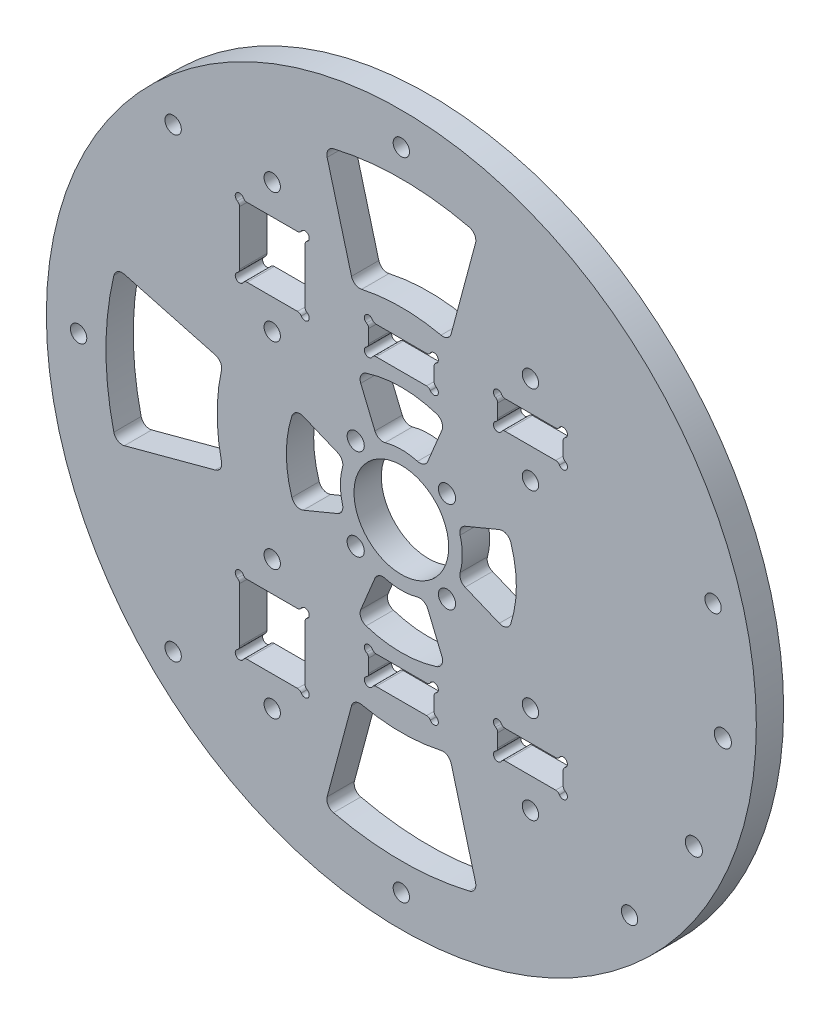
from build123d import *

# Parameters (mm, degrees)
SKETCH1_R                = 82.5
SKETCH1_R_2              = 1.89865
SKETCH1_R_3              = 1.9939
SKETCH1_R_4              = 11
BOSS_EXTRUDE1_DEPTH      = 6.35
SKETCH5_W                = 15.2
SKETCH5_H                = 16.075
CUT_EXTRUDE4_DEPTH       = 117.845293016
SKETCH6_R                = 1
CUT_EXTRUDE5_DEPTH       = 117.845293016
FILLET1_R                = 1
SKETCH10_W               = 52.512742007
SKETCH10_H               = 39.376351637
SKETCH10_W_2             = 54.285324016
SKETCH10_H_2             = 41.487938284
BOSS_EXTRUDE2_DEPTH      = 6.35
SKETCH11_W               = 15.2
SKETCH11_H               = 6.55
CUT_EXTRUDE8_DEPTH       = 117.845293016
SKETCH13_R               = 1
CUT_EXTRUDE9_DEPTH       = 117.845293016
FILLET2_R                = 1
LPATTERN3_COUNT          = 2
LPATTERN3_PITCH          = 30
FILLET2_OF_LPATTERN3_R   = 1
MIRROR3_DEPTH            = 6.35
SKETCH14_R               = 1.89865
CUT_EXTRUDE10_DEPTH      = 117.845293016
CUT_EXTRUDE11_DEPTH      = 10
FILLET3_R                = 2
CIRPATTERN1_COUNT        = 4
FILLET3_OF_CIRPATTERN1_R = 2
CUT_EXTRUDE12_DEPTH      = 117.845293016
FILLET4_R                = 2
CIRPATTERN2_COUNT        = 4
FILLET4_OF_CIRPATTERN2_R = 2
CUT_EXTRUDE13_START      = -3.571875
SKETCH17_R               = 4.7625
SKETCH17_R_2             = 1.89865
CUT_EXTRUDE13_DEPTH      = 3.571875


# Read off the part's stored shape, not the designer's step: Mirror3
with BuildPart() as part:
    # Sketch1 → Boss-Extrude1 (new body)
    with BuildSketch(Plane.XY):
        Circle(SKETCH1_R)
        with Locations((72.444436972, 19.411428383)):
            Circle(SKETCH1_R_2, mode=Mode.SUBTRACT)
        with Locations((74.714602357, -6.536680706)):
            Circle(SKETCH1_R_3, mode=Mode.SUBTRACT)
        Circle(SKETCH1_R_4, mode=Mode.SUBTRACT)
        with Locations((67.973084028, -31.696369631)):
            Circle(SKETCH1_R_3, mode=Mode.SUBTRACT)
        with Locations((10.606601718, -10.606601718)):
            Circle(SKETCH1_R_3, mode=Mode.SUBTRACT)
        with Locations((0, -75)):
            Circle(SKETCH1_R_2, mode=Mode.SUBTRACT)
        with Locations((-10.606601718, -10.606601718)):
            Circle(SKETCH1_R_3, mode=Mode.SUBTRACT)
        with Locations((-10.606601718, 10.606601718)):
            Circle(SKETCH1_R_3, mode=Mode.SUBTRACT)
        with Locations((10.606601718, 10.606601718)):
            Circle(SKETCH1_R_3, mode=Mode.SUBTRACT)
        with Locations((-53.033008589, -53.033008589)):
            Circle(SKETCH1_R_2, mode=Mode.SUBTRACT)
        with Locations((-75, 0)):
            Circle(SKETCH1_R_2, mode=Mode.SUBTRACT)
        with Locations((-53.033008589, 53.033008589)):
            Circle(SKETCH1_R_2, mode=Mode.SUBTRACT)
        with Locations((0, 75)):
            Circle(SKETCH1_R_2, mode=Mode.SUBTRACT)
        with Locations((53.033008589, -53.033008589)):
            Circle(SKETCH1_R_2, mode=Mode.SUBTRACT)
    extrude(amount=BOSS_EXTRUDE1_DEPTH)

    # Sketch5 → Cut-Extrude4 (cut, through all)
    with BuildSketch(Plane.XY.offset(6.35)):
        with Locations((-30, -37.9375)):
            Rectangle(SKETCH5_W, SKETCH5_H)
        with Locations((-30, 37.9375)):
            Rectangle(SKETCH5_W, SKETCH5_H)
        with Locations((30, 37.9375)):
            Rectangle(SKETCH5_W, SKETCH5_H)
        with Locations((0, -37.9375)):
            Rectangle(SKETCH5_W, SKETCH5_H)
        with Locations((30, -37.9375)):
            Rectangle(SKETCH5_W, SKETCH5_H)
        with Locations((0, 37.9375)):
            Rectangle(SKETCH5_W, SKETCH5_H)
    extrude(amount=-CUT_EXTRUDE4_DEPTH, mode=Mode.SUBTRACT)

    # Sketch6 → Cut-Extrude5 (cut, through all)
    with BuildSketch(Plane.XY.offset(6.35)):
        with Locations((-37.6, 45.975)):
            Circle(SKETCH6_R)
        with Locations((-22.4, 45.975)):
            Circle(SKETCH6_R)
        with Locations((-37.6, 29.9)):
            Circle(SKETCH6_R)
        with Locations((-22.4, 29.9)):
            Circle(SKETCH6_R)
        with Locations((-7.6, 45.975)):
            Circle(SKETCH6_R)
        with Locations((7.6, 45.975)):
            Circle(SKETCH6_R)
        with Locations((-7.6, 29.9)):
            Circle(SKETCH6_R)
        with Locations((7.6, 29.9)):
            Circle(SKETCH6_R)
        with Locations((22.4, 45.975)):
            Circle(SKETCH6_R)
        with Locations((37.6, 45.975)):
            Circle(SKETCH6_R)
        with Locations((22.4, 29.9)):
            Circle(SKETCH6_R)
        with Locations((37.6, 29.9)):
            Circle(SKETCH6_R)
        with Locations((-37.6, -29.9)):
            Circle(SKETCH6_R)
        with Locations((-22.4, -29.9)):
            Circle(SKETCH6_R)
        with Locations((-37.6, -45.975)):
            Circle(SKETCH6_R)
        with Locations((-22.4, -45.975)):
            Circle(SKETCH6_R)
        with Locations((-7.6, -29.9)):
            Circle(SKETCH6_R)
        with Locations((7.6, -29.9)):
            Circle(SKETCH6_R)
        with Locations((-7.6, -45.975)):
            Circle(SKETCH6_R)
        with Locations((7.6, -45.975)):
            Circle(SKETCH6_R)
        with Locations((22.4, -29.9)):
            Circle(SKETCH6_R)
        with Locations((37.6, -29.9)):
            Circle(SKETCH6_R)
        with Locations((22.4, -45.975)):
            Circle(SKETCH6_R)
        with Locations((37.6, -45.975)):
            Circle(SKETCH6_R)
    extrude(amount=-CUT_EXTRUDE5_DEPTH, mode=Mode.SUBTRACT)

    # Fillet1
    fillet1_edges = [part.edges().sort_by_distance(p)[0] for p in [
        (-37.6, 44.975, 3.175),
        (-36.6, 45.975, 3.175),
        (-22.4, 44.975, 3.175),
        (-23.4, 45.975, 3.175),
        (-37.6, 30.9, 3.175),
        (-36.6, 29.9, 3.175),
        (-23.4, 29.9, 3.175),
        (-22.4, 30.9, 3.175),
        (-7.6, 44.975, 3.175),
        (-6.6, 45.975, 3.175),
        (7.6, 44.975, 3.175),
        (6.6, 45.975, 3.175),
        (-7.6, 30.9, 3.175),
        (-6.6, 29.9, 3.175),
        (6.6, 29.9, 3.175),
        (7.6, 30.9, 3.175),
        (22.4, 44.975, 3.175),
        (23.4, 45.975, 3.175),
        (37.6, 44.975, 3.175),
        (36.6, 45.975, 3.175),
        (22.4, 30.9, 3.175),
        (23.4, 29.9, 3.175),
        (36.6, 29.9, 3.175),
        (37.6, 30.9, 3.175),
        (-36.6, -29.9, 3.175),
        (-37.6, -30.9, 3.175),
        (-22.4, -30.9, 3.175),
        (-23.4, -29.9, 3.175),
        (-36.6, -45.975, 3.175),
        (-37.6, -44.975, 3.175),
        (-23.4, -45.975, 3.175),
        (-22.4, -44.975, 3.175),
        (-6.6, -29.9, 3.175),
        (-7.6, -30.9, 3.175),
        (7.6, -30.9, 3.175),
        (6.6, -29.9, 3.175),
        (-6.6, -45.975, 3.175),
        (-7.6, -44.975, 3.175),
        (6.6, -45.975, 3.175),
        (7.6, -44.975, 3.175),
        (23.4, -29.9, 3.175),
        (22.4, -30.9, 3.175),
        (37.6, -30.9, 3.175),
        (36.6, -29.9, 3.175),
        (23.4, -45.975, 3.175),
        (22.4, -44.975, 3.175),
        (36.6, -45.975, 3.175),
        (37.6, -44.975, 3.175),
    ]]
    fillet(fillet1_edges, radius=FILLET1_R)

    # Sketch10 → Boss-Extrude2 (add, through all)
    with BuildSketch(Plane(origin=(0, 0, 0), x_dir=(-1, 0, 0), z_dir=(0, 0, -1))):
        with Locations((-14.291442444, 45.267678683)):
            Rectangle(SKETCH10_W, SKETCH10_H)
        with Locations((-15.177733449, -45.976574892)):
            Rectangle(SKETCH10_W_2, SKETCH10_H_2)
    extrude(amount=-BOSS_EXTRUDE2_DEPTH)

    # Sketch11 → Cut-Extrude8 (cut, through all)
    with BuildSketch(Plane(origin=(0, 0, 0), x_dir=(-1, 0, 0), z_dir=(0, 0, -1))):
        with Locations((0, 33.175)):
            Rectangle(SKETCH11_W, SKETCH11_H)
    cut_extrude8 = extrude(amount=-CUT_EXTRUDE8_DEPTH, mode=Mode.SUBTRACT)

    # Sketch13 → Cut-Extrude9 (cut, through all)
    with BuildSketch(Plane(origin=(0, 0, 0), x_dir=(-1, 0, 0), z_dir=(0, 0, -1))):
        with Locations((-7.6, 36.45)):
            Circle(SKETCH13_R)
        with Locations((-7.6, 29.9)):
            Circle(SKETCH13_R)
        with Locations((7.6, 29.9)):
            Circle(SKETCH13_R)
        with Locations((7.6, 36.45)):
            Circle(SKETCH13_R)
    cut_extrude9 = extrude(amount=-CUT_EXTRUDE9_DEPTH, mode=Mode.SUBTRACT)

    # Fillet2
    fillet2_edges = [part.edges().sort_by_distance(p)[0] for p in [
        (6.6, 36.45, 3.175),
        (7.6, 35.45, 3.175),
        (-6.6, 36.45, 3.175),
        (7.6, 30.9, 3.175),
        (-6.6, 29.9, 3.175),
        (6.6, 29.9, 3.175),
        (-7.6, 30.9, 3.175),
        (-7.6, 35.45, 3.175),
    ]]
    fillet(fillet2_edges, radius=FILLET2_R)

    # LPattern3: Cut-Extrude8, Cut-Extrude9 ×2
    with Locations(*[(i * LPATTERN3_PITCH, 0, 0) for i in range(1, LPATTERN3_COUNT)]):
        add(cut_extrude8, mode=Mode.SUBTRACT)
        add(cut_extrude9, mode=Mode.SUBTRACT)

    # Fillet2 of LPattern3
    fillet2_of_lpattern3_edges = [part.edges().sort_by_distance(p)[0] for p in [
        (36.6, 36.45, 3.175),
        (37.6, 35.45, 3.175),
        (23.4, 36.45, 3.175),
        (37.6, 30.9, 3.175),
        (23.4, 29.9, 3.175),
        (36.6, 29.9, 3.175),
        (22.4, 30.9, 3.175),
        (22.4, 35.45, 3.175),
    ]]
    fillet(fillet2_of_lpattern3_edges, radius=FILLET2_OF_LPATTERN3_R)

    # Mirror3 outline → Mirror3 (cut)
    with BuildSketch(Plane.XY):
        with BuildLine():
            Line((-5.867949192, -36.45), (5.867949192, -36.45))
            ThreePointArc((5.867949192, -36.45), (6.367949192, -36.583974596), (6.733974596, -36.95))
            ThreePointArc((6.733974596, -36.95), (8.307106781, -37.157106781), (8.1, -35.583974596))
            ThreePointArc((8.1, -35.583974596), (7.733974596, -35.217949192), (7.6, -34.717949192))
            Line((7.6, -34.717949192), (7.6, -31.632050808))
            ThreePointArc((7.6, -31.632050808), (7.733974596, -31.132050808), (8.1, -30.766025404))
            ThreePointArc((8.1, -30.766025404), (8.307106781, -29.192893219), (6.733974596, -29.4))
            ThreePointArc((6.733974596, -29.4), (6.367949192, -29.766025404), (5.867949192, -29.9))
            Line((5.867949192, -29.9), (-5.867949192, -29.9))
            ThreePointArc((-5.867949192, -29.9), (-6.367949192, -29.766025404), (-6.733974596, -29.4))
            ThreePointArc((-6.733974596, -29.4), (-8.307106781, -29.192893219), (-8.1, -30.766025404))
            ThreePointArc((-8.1, -30.766025404), (-7.733974596, -31.132050808), (-7.6, -31.632050808))
            Line((-7.6, -31.632050808), (-7.6, -34.717949192))
            ThreePointArc((-7.6, -34.717949192), (-7.733974596, -35.217949192), (-8.1, -35.583974596))
            ThreePointArc((-8.1, -35.583974596), (-8.307106781, -37.157106781), (-6.733974596, -36.95))
            ThreePointArc((-6.733974596, -36.95), (-6.367949192, -36.583974596), (-5.867949192, -36.45))
        make_face()
        with BuildLine():
            Line((24.132050808, -36.45), (35.867949192, -36.45))
            ThreePointArc((35.867949192, -36.45), (36.367949192, -36.583974596), (36.733974596, -36.95))
            ThreePointArc((36.733974596, -36.95), (38.307106781, -37.157106781), (38.1, -35.583974596))
            ThreePointArc((38.1, -35.583974596), (37.733974596, -35.217949192), (37.6, -34.717949192))
            Line((37.6, -34.717949192), (37.6, -31.632050808))
            ThreePointArc((37.6, -31.632050808), (37.733974596, -31.132050808), (38.1, -30.766025404))
            ThreePointArc((38.1, -30.766025404), (38.307106781, -29.192893219), (36.733974596, -29.4))
            ThreePointArc((36.733974596, -29.4), (36.367949192, -29.766025404), (35.867949192, -29.9))
            Line((35.867949192, -29.9), (24.132050808, -29.9))
            ThreePointArc((24.132050808, -29.9), (23.632050808, -29.766025404), (23.266025404, -29.4))
            ThreePointArc((23.266025404, -29.4), (21.692893219, -29.192893219), (21.9, -30.766025404))
            ThreePointArc((21.9, -30.766025404), (22.266025404, -31.132050808), (22.4, -31.632050808))
            Line((22.4, -31.632050808), (22.4, -34.717949192))
            ThreePointArc((22.4, -34.717949192), (22.266025404, -35.217949192), (21.9, -35.583974596))
            ThreePointArc((21.9, -35.583974596), (21.692893219, -37.157106781), (23.266025404, -36.95))
            ThreePointArc((23.266025404, -36.95), (23.632050808, -36.583974596), (24.132050808, -36.45))
        make_face()
    extrude(amount=MIRROR3_DEPTH, mode=Mode.SUBTRACT)

    # Sketch14 → Cut-Extrude10 (cut, through all)
    with BuildSketch(Plane.XY.offset(6.35)):
        with Locations((-30, 52.975)):
            Circle(SKETCH14_R)
        with Locations((-30, 22.9)):
            Circle(SKETCH14_R)
        with Locations((30, 43.45)):
            Circle(SKETCH14_R)
        with Locations((30, 22.9)):
            Circle(SKETCH14_R)
    cut_extrude10 = extrude(amount=-CUT_EXTRUDE10_DEPTH, mode=Mode.SUBTRACT)

    # Mirror4: Cut-Extrude10 across plane
    add(cut_extrude10.mirror(Plane.ZX), mode=Mode.SUBTRACT)

    # Sketch15 → Cut-Extrude11 (cut)
    with BuildSketch(Plane.XY.offset(6.35)):
        with BuildLine():
            Line((-10.22721473, 24.690680506), (-5.424537654, 13.095992373))
            ThreePointArc((-5.424537654, 13.095992373), (0, 14.175), (5.424537654, 13.095992373))
            Line((5.424537654, 13.095992373), (10.22721473, 24.690680506))
            ThreePointArc((10.22721473, 24.690680506), (0, 26.725), (-10.22721473, 24.690680506))
        make_face()
    cut_extrude11 = extrude(amount=-CUT_EXTRUDE11_DEPTH, mode=Mode.SUBTRACT)

    # Fillet3
    fillet3_edges = [part.edges().sort_by_distance(p)[0] for p in [
        (5.424537654, 13.095992373, 3.175),
        (-5.424537654, 13.095992373, 3.175),
        (-10.22721473, 24.690680506, 3.175),
        (10.22721473, 24.690680506, 3.175),
    ]]
    fillet(fillet3_edges, radius=FILLET3_R)

    # CirPattern1: Cut-Extrude11 ×4 about axis
    cirpattern1_axis = Axis((0, 0, 0), (0, 0, 1))
    for i in range(1, CIRPATTERN1_COUNT):
        add(cut_extrude11.rotate(cirpattern1_axis, i * 360 / CIRPATTERN1_COUNT), mode=Mode.SUBTRACT)

    # Fillet3 of CirPattern1
    fillet3_of_cirpattern1_edges = [part.edges().sort_by_distance(p)[0] for p in [
        (-13.095992373, 5.424537654, 3.175),
        (-13.095992373, -5.424537654, 3.175),
        (-24.690680506, -10.22721473, 3.175),
        (-24.690680506, 10.22721473, 3.175),
        (-5.424537654, -13.095992373, 3.175),
        (5.424537654, -13.095992373, 3.175),
        (10.22721473, -24.690680506, 3.175),
        (-10.22721473, -24.690680506, 3.175),
        (13.095992373, -5.424537654, 3.175),
        (13.095992373, 5.424537654, 3.175),
        (24.690680506, 10.22721473, 3.175),
        (24.690680506, -10.22721473, 3.175),
    ]]
    fillet(fillet3_of_cirpattern1_edges, radius=FILLET3_OF_CIRPATTERN1_R)

    # Sketch16 → Cut-Extrude12 (cut, through all)
    with BuildSketch(Plane.XY.offset(6.35)):
        with BuildLine():
            Line((17.767927446, -66.310807975), (11.07745513, -41.341625365))
            ThreePointArc((11.07745513, -41.341625365), (0, -42.8), (-11.07745513, -41.341625365))
            Line((-11.07745513, -41.341625365), (-17.767927446, -66.310807975))
            ThreePointArc((-17.767927446, -66.310807975), (0, -68.65), (17.767927446, -66.310807975))
        make_face()
    cut_extrude12 = extrude(amount=-CUT_EXTRUDE12_DEPTH, mode=Mode.SUBTRACT)

    # Fillet4
    fillet4_edges = [part.edges().sort_by_distance(p)[0] for p in [
        (-11.07745513, -41.341625365, 3.175),
        (11.07745513, -41.341625365, 3.175),
        (17.767927446, -66.310807975, 3.175),
        (-17.767927446, -66.310807975, 3.175),
    ]]
    fillet(fillet4_edges, radius=FILLET4_R)

    # CirPattern2: Cut-Extrude12 ×4 about axis, 1 skipped
    cirpattern2_axis = Axis((0, 0, 0), (0, 0, -1))
    add([cut_extrude12.rotate(cirpattern2_axis, i * 360 / CIRPATTERN2_COUNT) for i in range(1, CIRPATTERN2_COUNT) if i not in (3,)], mode=Mode.SUBTRACT)

    # Fillet4 of CirPattern2
    fillet4_of_cirpattern2_edges = [part.edges().sort_by_distance(p)[0] for p in [
        (-41.341625365, 11.07745513, 3.175),
        (-41.341625365, -11.07745513, 3.175),
        (-66.310807975, -17.767927446, 3.175),
        (-66.310807975, 17.767927446, 3.175),
        (11.07745513, 41.341625365, 3.175),
        (-11.07745513, 41.341625365, 3.175),
        (-17.767927446, 66.310807975, 3.175),
        (17.767927446, 66.310807975, 3.175),
    ]]
    fillet(fillet4_of_cirpattern2_edges, radius=FILLET4_OF_CIRPATTERN2_R)

    # Sketch17 → Cut-Extrude13 (cut)
    # profile 1 of 8: a face of its own
    with BuildSketch(Plane(origin=(0, 0, 0), x_dir=(-1, 0, 0), z_dir=(0, 0, -1)).offset(CUT_EXTRUDE13_START)):
        with Locations((30, -52.975)):
            Circle(SKETCH17_R)
        with Locations(Location((30, -52.975, 0), (0, 0, 180))):
            Circle(SKETCH17_R_2, mode=Mode.SUBTRACT)
    # profile 2 of 8: a face of its own
    with BuildSketch(Plane(origin=(0, 0, 0), x_dir=(-1, 0, 0), z_dir=(0, 0, -1)).offset(CUT_EXTRUDE13_START)):
        with Locations((30, -22.9)):
            Circle(SKETCH17_R)
        with Locations(Location((30, -22.9, 0), (0, 0, 180))):
            Circle(SKETCH17_R_2, mode=Mode.SUBTRACT)
    # profile 3 of 8: a face of its own
    with BuildSketch(Plane(origin=(0, 0, 0), x_dir=(-1, 0, 0), z_dir=(0, 0, -1)).offset(CUT_EXTRUDE13_START)):
        with Locations((-30, -43.45)):
            Circle(SKETCH17_R)
        with Locations(Location((-30, -43.45, 0), (0, 0, 180))):
            Circle(SKETCH17_R_2, mode=Mode.SUBTRACT)
    # profile 4 of 8: a face of its own
    with BuildSketch(Plane(origin=(0, 0, 0), x_dir=(-1, 0, 0), z_dir=(0, 0, -1)).offset(CUT_EXTRUDE13_START)):
        with Locations((-30, -22.9)):
            Circle(SKETCH17_R)
        with Locations(Location((-30, -22.9, 0), (0, 0, 180))):
            Circle(SKETCH17_R_2, mode=Mode.SUBTRACT)
    # profile 5 of 8: a face of its own
    with BuildSketch(Plane(origin=(0, 0, 0), x_dir=(-1, 0, 0), z_dir=(0, 0, -1)).offset(CUT_EXTRUDE13_START)):
        with Locations((-30, 22.9)):
            Circle(SKETCH17_R)
        with Locations(Location((-30, 22.9, 0), (0, 0, 180))):
            Circle(SKETCH17_R_2, mode=Mode.SUBTRACT)
    # profile 6 of 8: a face of its own
    with BuildSketch(Plane(origin=(0, 0, 0), x_dir=(-1, 0, 0), z_dir=(0, 0, -1)).offset(CUT_EXTRUDE13_START)):
        with Locations((-30, 43.45)):
            Circle(SKETCH17_R)
        with Locations(Location((-30, 43.45, 0), (0, 0, 180))):
            Circle(SKETCH17_R_2, mode=Mode.SUBTRACT)
    # profile 7 of 8: a face of its own
    with BuildSketch(Plane(origin=(0, 0, 0), x_dir=(-1, 0, 0), z_dir=(0, 0, -1)).offset(CUT_EXTRUDE13_START)):
        with Locations((30, 52.975)):
            Circle(SKETCH17_R)
        with Locations(Location((30, 52.975, 0), (0, 0, 180))):
            Circle(SKETCH17_R_2, mode=Mode.SUBTRACT)
    # profile 8 of 8: a face of its own
    with BuildSketch(Plane(origin=(0, 0, 0), x_dir=(-1, 0, 0), z_dir=(0, 0, -1)).offset(CUT_EXTRUDE13_START)):
        with Locations((30, 22.9)):
            Circle(SKETCH17_R)
        with Locations(Location((30, 22.9, 0), (0, 0, 180))):
            Circle(SKETCH17_R_2, mode=Mode.SUBTRACT)
    extrude(amount=CUT_EXTRUDE13_DEPTH, mode=Mode.SUBTRACT)


solid = part.part
